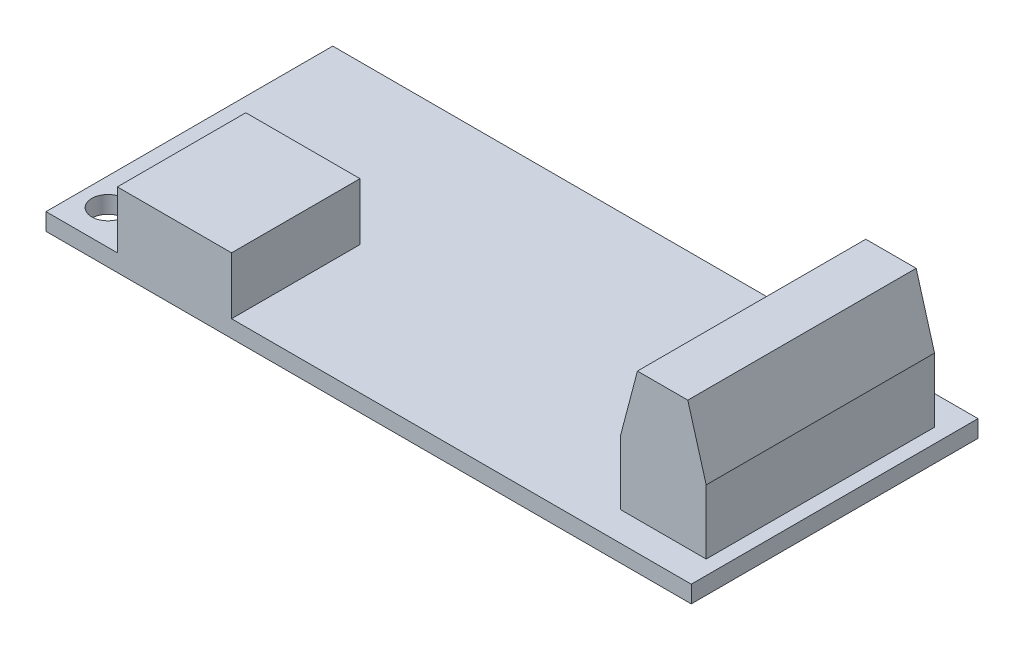
from build123d import *

# Parameters (mm, degrees)
SKETCH1_W           = 45.21
SKETCH1_H           = 20.09
SKETCH1_R           = 1.13
BOSS_EXTRUDE1_DEPTH = 1.2
SKETCH2_W           = 6
SKETCH2_H           = 16
BOSS_EXTRUDE3_DEPTH = 9
CUT_EXTRUDE1_REACH  = 32.67
SKETCH5_W           = 8
SKETCH5_H           = 9
BOSS_EXTRUDE5_DEPTH = 4


with BuildPart() as part:
    # Sketch1 → Boss-Extrude1 (new body)
    with BuildSketch(Plane(origin=(0, 0, 0), x_dir=(1, 0, 0), z_dir=(0, 1, 0))):
        Rectangle(SKETCH1_W, SKETCH1_H)
        with Locations((11.835, 7.785)):
            Circle(SKETCH1_R, mode=Mode.SUBTRACT)
        with Locations((-20.675, -7.635)):
            Circle(SKETCH1_R, mode=Mode.SUBTRACT)
    extrude(amount=BOSS_EXTRUDE1_DEPTH)

    # Sketch2 → Boss-Extrude3 (add)
    with BuildSketch(Plane(origin=(0, 1.2, 0), x_dir=(1, 0, 0), z_dir=(0, 1, 0))):
        with Locations((18.605, 0)):
            Rectangle(SKETCH2_W, SKETCH2_H)
    extrude(amount=BOSS_EXTRUDE3_DEPTH)

    # Sketch4 → Cut-Extrude1 (cut, up to next)
    with BuildSketch(Plane.XY.offset(8), mode=Mode.PRIVATE) as cut_extrude1_sk1:
        Polygon((15.605, 5.7), (16.788227765, 10.2), (15.605, 10.2), align=None)
    cut_extrude1_tool1 = extrude(cut_extrude1_sk1.sketch, amount=-CUT_EXTRUDE1_REACH, mode=Mode.PRIVATE) & part.part
    # Sketch4 → Cut-Extrude1 (cut, up to next)
    with BuildSketch(Plane.XY.offset(8), mode=Mode.PRIVATE) as cut_extrude1_sk2:
        Polygon((20.317369028, 10.2), (21.605, 5.7), (21.605, 10.2), align=None)
    cut_extrude1_tool2 = extrude(cut_extrude1_sk2.sketch, amount=-CUT_EXTRUDE1_REACH, mode=Mode.PRIVATE) & part.part
    add(cut_extrude1_tool1.solids().sort_by_distance((15.999409, 8.7, 8))[0], mode=Mode.SUBTRACT)
    add(cut_extrude1_tool2.solids().sort_by_distance((21.17579, 8.7, 8))[0], mode=Mode.SUBTRACT)

    # Sketch5 → Boss-Extrude5 (add)
    with BuildSketch(Plane(origin=(0, 1.2, 0), x_dir=(1, 0, 0), z_dir=(0, 1, 0))):
        with Locations((-13.605, -5.545)):
            Rectangle(SKETCH5_W, SKETCH5_H)
    extrude(amount=BOSS_EXTRUDE5_DEPTH)


solid = part.part
